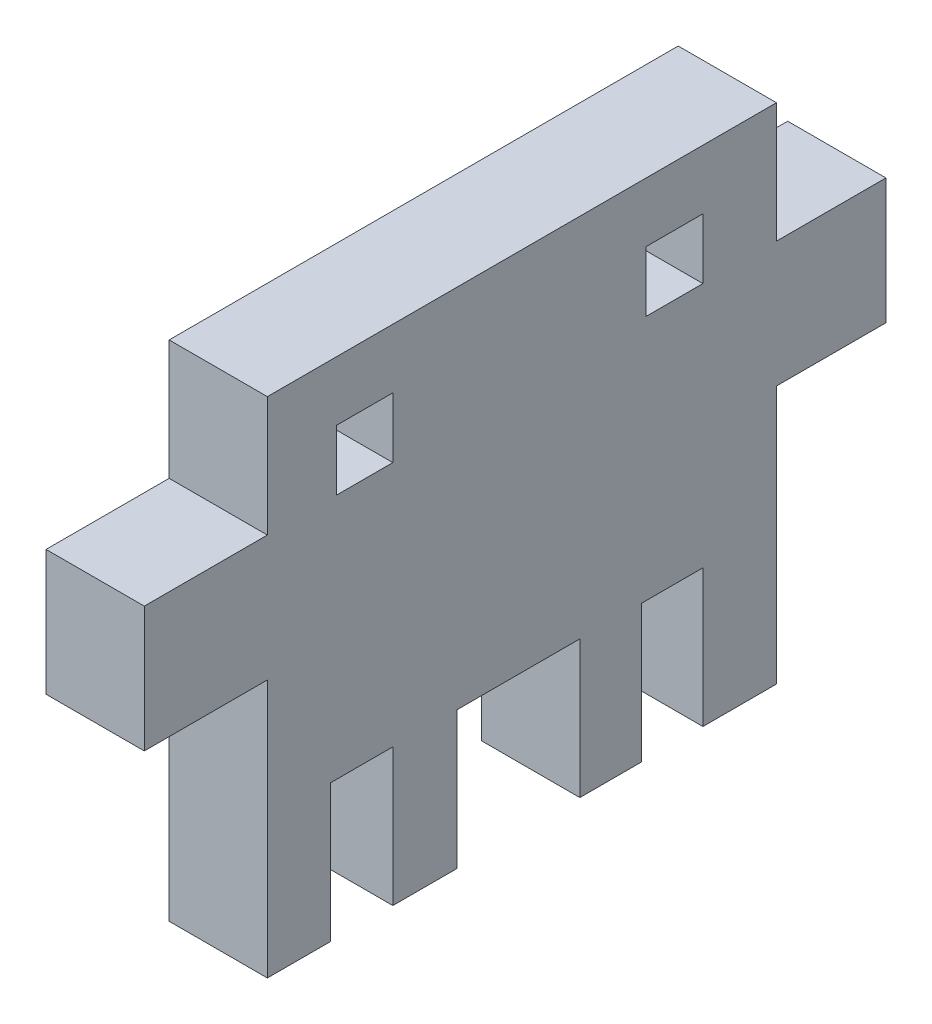
from build123d import *

# Parameters (mm, degrees)
SKETCH_2_W      = 11.455249919
SKETCH_2_H      = 12.30850899
SKETCH_2_W_2    = 11.610466877
EXTRUDE_1_DEPTH = 20


with BuildPart() as part:
    # 草图2 → 凸台-拉伸1 (new body)
    with BuildSketch(Plane(origin=(0, 0, 0), x_dir=(0, 0, -1), z_dir=(1, 0, 0))):
        Polygon((109.966739456, 259.080980256), (122.984522294, 259.080980256), (122.984522294, 287.06921336), (148.043754259, 287.06921336), (148.043754259, 259.080980256), (160.573370241, 259.080980256), (160.573370241, 287.06921336), (173.102986224, 287.06921336), (173.102986224, 259.080980256), (188.073436488, 259.080980256), (188.073436488, 311.640278468), (210.3663896, 311.640278468), (210.3663896, 337.187677289), (188.073436488, 337.187677289), (188.073436488, 361.596020112), (84.419340634, 361.596020112), (84.419340634, 337.187677289), (59.36010867, 337.187677289), (59.36010867, 311.640278468), (84.419340634, 311.640278468), (84.419340634, 259.080980256), (97.274401188, 259.080980256), (97.274401188, 287.06921336), (109.966739456, 287.06921336), align=None)
        with Locations((104.239114497, 343.341931784)):
            Rectangle(SKETCH_2_W, SKETCH_2_H, mode=Mode.SUBTRACT)
        with Locations((167.297752785, 343.341931784)):
            Rectangle(SKETCH_2_W_2, SKETCH_2_H, mode=Mode.SUBTRACT)
    extrude(amount=EXTRUDE_1_DEPTH)


solid = part.part
